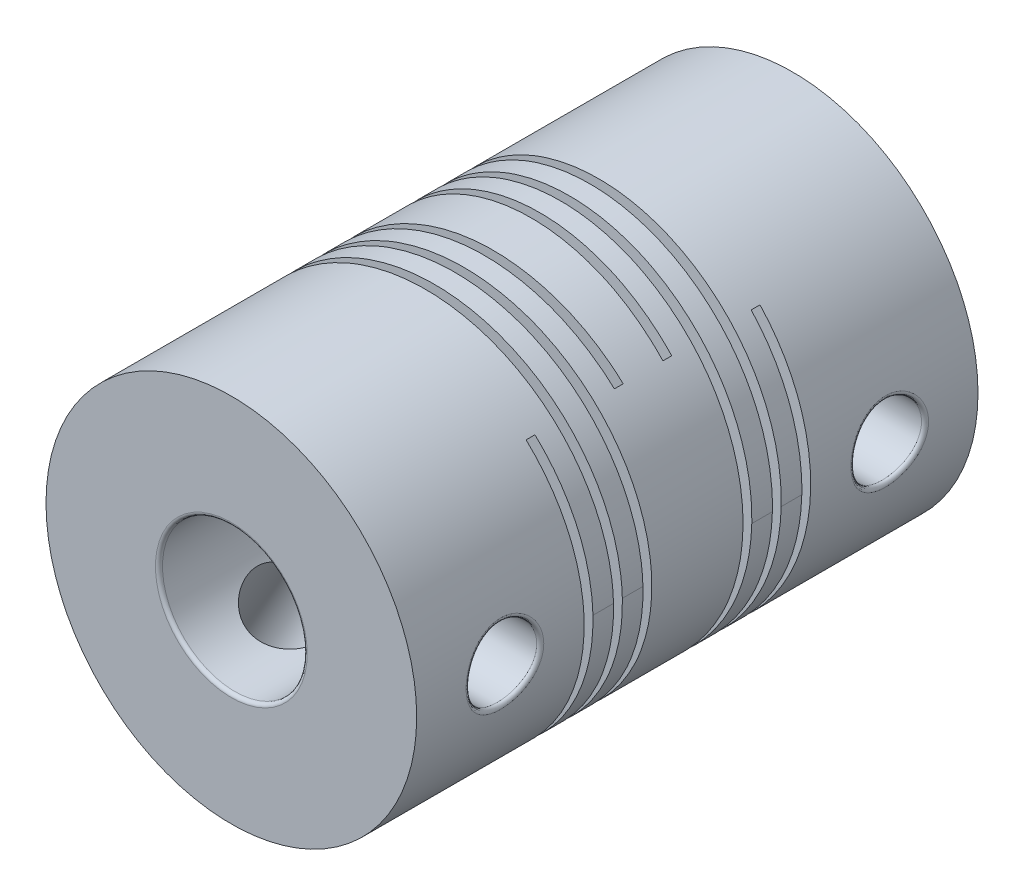
from build123d import *

# Parameters (mm, degrees)
SALIENTE_EXTRUIR1_DEPTH      = 15.9
SALIENTE_EXTRUIR1_DEPTH_BACK = 15.9
CROQUIS1_R                   = 10.5
CROQUIS2_R                   = 4.1
CORTAR_EXTRUIR1_DEPTH        = 10
CORTAR_EXTRUIR2_START        = -10
CROQUIS3_R                   = 4.1
CORTAR_EXTRUIR2_DEPTH        = 10
CORTAR_EXTRUIR3_DEPTH        = 6
CORTAR_EXTRUIR3_DEPTH_BACK   = 6
CROQUIS4_R                   = 5
CORTAR_EXTRUIR4_START        = 2
CROQUIS5_R                   = 2
CORTAR_EXTRUIR4_DEPTH        = 10
MATRIZC1_COUNT               = 2
MATRIZC1_ANGLE               = 240
SIMETR_A1_START              = 2
SIMETR_A1_COPY_1_SKETCH_R    = 2
SIMETR_A1_COPY_1_DEPTH       = 10
CORTAR_BARRER1_PITCH         = 1.666666667
REDONDEO1_R                  = 0.2


with BuildPart() as part:
    # Croquis1 → Saliente-Extruir1 (new, two sides: drawn at the far end of the back side and taken through both)
    with BuildSketch(Plane.XY.offset(-SALIENTE_EXTRUIR1_DEPTH_BACK)):
        Circle(CROQUIS1_R)
    extrude(amount=SALIENTE_EXTRUIR1_DEPTH + SALIENTE_EXTRUIR1_DEPTH_BACK)

    # Croquis2 → Cortar-Extruir1 (cut)
    with BuildSketch(Plane.XY.offset(15.9)):
        Circle(CROQUIS2_R)
    extrude(amount=-CORTAR_EXTRUIR1_DEPTH, mode=Mode.SUBTRACT)

    # Croquis3 → Cortar-Extruir2 (cut)
    with BuildSketch(Plane(origin=(0, 0, -15.9), x_dir=(-1, 0, 0), z_dir=(0, 0, -1)).offset(CORTAR_EXTRUIR2_START)):
        with Locations(Location((0, 0, 0), (0, 0, 180))):
            Circle(CROQUIS3_R)
    extrude(amount=CORTAR_EXTRUIR2_DEPTH, mode=Mode.SUBTRACT)

    # Croquis4 → Cortar-Extruir3 (cut, two sides: drawn at the far end of the back side and taken through both)
    with BuildSketch(Plane.XY.offset(-CORTAR_EXTRUIR3_DEPTH_BACK)):
        Circle(CROQUIS4_R)
    extrude(amount=CORTAR_EXTRUIR3_DEPTH + CORTAR_EXTRUIR3_DEPTH_BACK, mode=Mode.SUBTRACT)

    # Croquis5 → Cortar-Extruir4 (cut)
    with BuildSketch(Plane(origin=(0, 0, 0), x_dir=(0, 0, -1), z_dir=(1, 0, 0)).offset(CORTAR_EXTRUIR4_START)):
        with Locations(Location((-10.9, 0, 0), (0, 0, 180))):
            Circle(CROQUIS5_R)
    cortar_extruir4 = extrude(amount=CORTAR_EXTRUIR4_DEPTH, mode=Mode.SUBTRACT)

    # MatrizC1: Cortar-Extruir4 ×2 about axis
    matrizc1_axis = Axis((0, 0, -15.9), (0, 0, 1))
    for i in range(1, MATRIZC1_COUNT):
        add(cortar_extruir4.rotate(matrizc1_axis, i * MATRIZC1_ANGLE / (MATRIZC1_COUNT - 1)), mode=Mode.SUBTRACT)

    # Simetría1: Cortar-Extruir4 across plane
    add(cortar_extruir4.mirror(Plane.XY), mode=Mode.SUBTRACT)

    # Simetría1 copy 1 sketch → Simetría1 copy 1 (cut)
    with BuildSketch(Plane(origin=(0, 0, 0), x_dir=(0, 0, 1), z_dir=(-0.4999999999999912, -0.8660254037844437, 0)).offset(SIMETR_A1_START)):
        with Locations((-10.9, 0)):
            Circle(SIMETR_A1_COPY_1_SKETCH_R)
    extrude(amount=SIMETR_A1_COPY_1_DEPTH, mode=Mode.SUBTRACT)

    # Cortar-Barrer1: arcs per turn and ends read off the stored shape
    # Cortar-Barrer1: the profile of Croquis7 profile screwed along a right-hand helix through 3 turns, 8 arcs to a turn; built about Z, then put on its axis
    cortar_barrer1_z = Axis((0, 0, 0), (0, 0, 1))
    cortar_barrer1_corners = [(10.5003, 0, -0.625), (10.5003, 0, -0.125), (5.94, 0, -0.125), (5.94, 0, -0.625)]
    with BuildLine(mode=Mode.PRIVATE) as cortar_barrer1_profile:
        Line(cortar_barrer1_corners[0], cortar_barrer1_corners[1])
        Line(cortar_barrer1_corners[1], cortar_barrer1_corners[2])
        Line(cortar_barrer1_corners[2], cortar_barrer1_corners[3])
        Line(cortar_barrer1_corners[3], cortar_barrer1_corners[0])
    cortar_barrer1_cap = Face(cortar_barrer1_profile.wire())
    cortar_barrer1_turn_angles = [0, 22.5, 45, 67.5, 90, 112.5, 135, 157.5, 180, 202.5, 225, 247.5, 270, 292.5, 315, 337.5, 360]
    cortar_barrer1_turn_weights = [1, 0.9238795325112867, 1, 0.9238795325112867, 1, 0.9238795325112867, 1, 0.9238795325112867, 1, 0.9238795325112867, 1, 0.9238795325112867, 1, 0.9238795325112867, 1, 0.9238795325112867, 1]
    cortar_barrer1_turn_rails = [Edge.make_bspline([Vector(p[0], p[1], 0).rotate(cortar_barrer1_z, cortar_barrer1_turn_angles[k]) / cortar_barrer1_turn_weights[k] + Vector(0, 0, p[2] + CORTAR_BARRER1_PITCH * cortar_barrer1_turn_angles[k] / 360) for k in range(17)], [0, 0, 0, 1, 1, 2, 2, 3, 3, 4, 4, 5, 5, 6, 6, 7, 7, 8, 8, 8], 2, cortar_barrer1_turn_weights) for p in cortar_barrer1_corners]
    cortar_barrer1_turn_sides = [Face.make_surface_from_curves(cortar_barrer1_turn_rails[p[0]], cortar_barrer1_turn_rails[p[1]]) for p in [(0, 1), (1, 2), (2, 3), (3, 0)]]
    cortar_barrer1 = Plane(origin=(0, 0, 6), x_dir=(0.7071067811865464, 0.7071067811865488, 0), z_dir=(0, 0, -1)) * Solid(Shell([*[p.moved(Location((0, 0, CORTAR_BARRER1_PITCH * i))) for i in range(3) for p in cortar_barrer1_turn_sides], cortar_barrer1_cap, cortar_barrer1_cap.rotate(cortar_barrer1_z, 1080).moved(Location((0, 0, CORTAR_BARRER1_PITCH * 1080 / 360)))]))
    add(cortar_barrer1, mode=Mode.SUBTRACT)

    # Simetría2: Cortar-Barrer1 across plane
    add(cortar_barrer1.mirror(Plane.XY), mode=Mode.SUBTRACT)

    # Redondeo1
    redondeo1_edges = [part.edges().sort_by_distance(p)[0] for p in [
        (-4.1, 0, -15.9),
        (10.307764064, 2, 10.9),
        (-5.25, -9.093266738, 8.899999988),
        (10.307764064, -2, -10.9),
        (-5.25, -9.093266738, -12.900000012),
        (-4.1, 0, 15.9),
    ]]
    fillet(redondeo1_edges, radius=REDONDEO1_R)


solid = part.part
